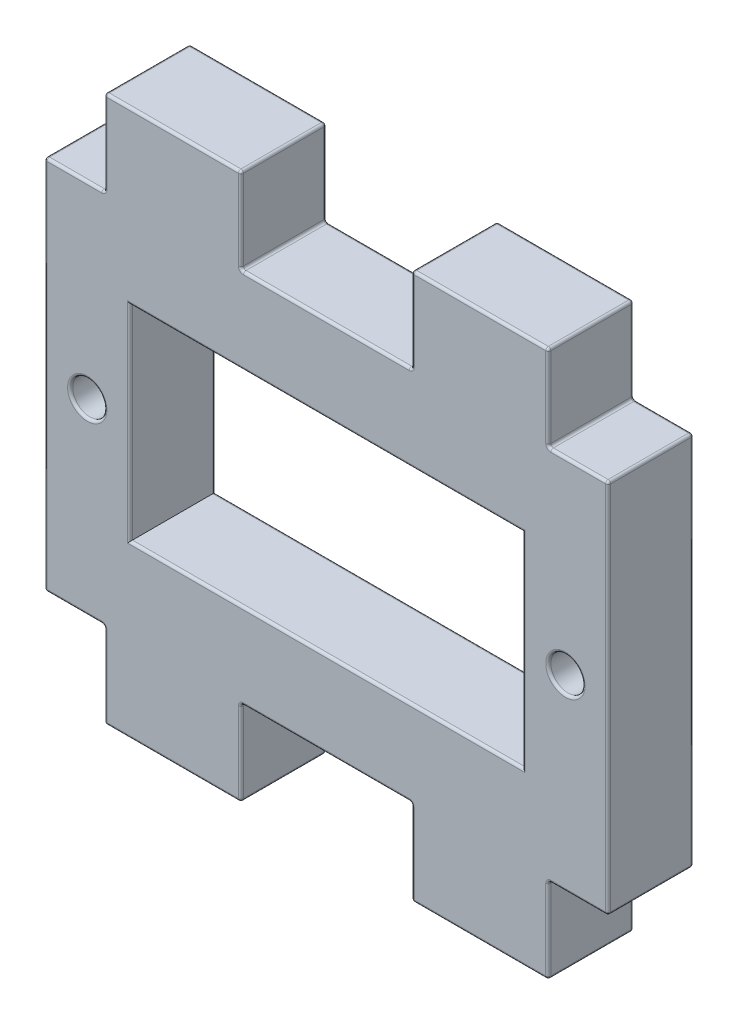
from build123d import *

# Parameters (mm, degrees)
SZKIC1_R                    = 1
SZKIC1_W                    = 23
SZKIC1_H                    = 12
DODANIE_WYCI_GNI_CIE1_DEPTH = 2.5
ZAOKR_GLENIE1_R             = 0.15
ZAOKR_GLENIE2_R             = 0.15


with BuildPart() as part:
    # Szkic1 → Dodanie-wyciągnięcie1 (new, symmetric)
    with BuildSketch(Plane.XY):
        Polygon((-13, 11), (-16.5, 11), (-16.5, -11), (-13, -11), (-13, -16), (-5, -16), (-5, -11), (5, -11), (5, -16), (13, -16), (13, -11), (16.5, -11), (16.5, 11), (13, 11), (13, 16), (5, 16), (5, 11), (-5, 11), (-5, 16), (-13, 16), align=None)
        with Locations((-14, 0)):
            Circle(SZKIC1_R, mode=Mode.SUBTRACT)
        Rectangle(SZKIC1_W, SZKIC1_H, mode=Mode.SUBTRACT)
        with Locations((14, 0)):
            Circle(SZKIC1_R, mode=Mode.SUBTRACT)
    extrude(amount=DODANIE_WYCI_GNI_CIE1_DEPTH, both=True)

    # Zaokrąglenie1
    zaokr_glenie1_edges = [part.edges().sort_by_distance(p)[0] for p in [
        (-13, 16, 0),
        (-9, 16, -2.5),
        (-13, 13.5, -2.5),
        (-9, 16, 2.5),
        (-5, 16, 0),
        (-13, 13.5, 2.5),
        (-13, 11, 0),
        (-5, 13.5, -2.5),
        (-14.75, 11, -2.5),
        (-5, 13.5, 2.5),
        (-5, 11, 0),
        (-14.75, 11, 2.5),
        (-16.5, 11, 0),
        (0, 11, -2.5),
        (-16.5, 0, -2.5),
        (0, 11, 2.5),
        (5, 11, 0),
        (-16.5, 0, 2.5),
        (-16.5, -11, 0),
        (5, 13.5, -2.5),
        (-14.75, -11, -2.5),
        (5, 13.5, 2.5),
        (5, 16, 0),
        (-13, -11, 0),
        (-14.75, -11, 2.5),
        (9, 16, -2.5),
        (-13, -13.5, -2.5),
        (13, 16, 0),
        (9, 16, 2.5),
        (-13, -16, 0),
        (-13, -13.5, 2.5),
        (13, 13.5, -2.5),
        (-9, -16, -2.5),
        (13, 13.5, 2.5),
        (13, 11, 0),
        (-5, -16, 0),
        (-9, -16, 2.5),
        (14.75, 11, -2.5),
        (-5, -13.5, -2.5),
        (14.75, 11, 2.5),
        (16.5, 11, 0),
        (-5, -13.5, 2.5),
        (-5, -11, 0),
        (16.5, 0, -2.5),
        (0, -11, -2.5),
        (16.5, -11, 0),
        (16.5, 0, 2.5),
        (5, -11, 0),
        (0, -11, 2.5),
        (14.75, -11, -2.5),
        (5, -13.5, -2.5),
        (14.75, -11, 2.5),
        (13, -11, 0),
        (5, -16, 0),
        (5, -13.5, 2.5),
        (13, -13.5, -2.5),
        (9, -16, -2.5),
        (13, -13.5, 2.5),
        (9, -16, 2.5),
        (13, -16, 0),
    ]]
    fillet(zaokr_glenie1_edges, radius=ZAOKR_GLENIE1_R)

    # Zaokrąglenie2
    zaokr_glenie2_edges = [part.edges().sort_by_distance(p)[0] for p in [
        (13, 0, -2.5),
        (-15, 0, -2.5),
        (0, -6, -2.5),
        (-11.5, 0, -2.5),
        (0, 6, -2.5),
        (11.5, 0, -2.5),
        (0, 6, 2.5),
        (-11.5, 0, 2.5),
        (0, -6, 2.5),
        (11.5, 0, 2.5),
        (-15, 0, 2.5),
        (13, 0, 2.5),
    ]]
    fillet(zaokr_glenie2_edges, radius=ZAOKR_GLENIE2_R)


solid = part.part
